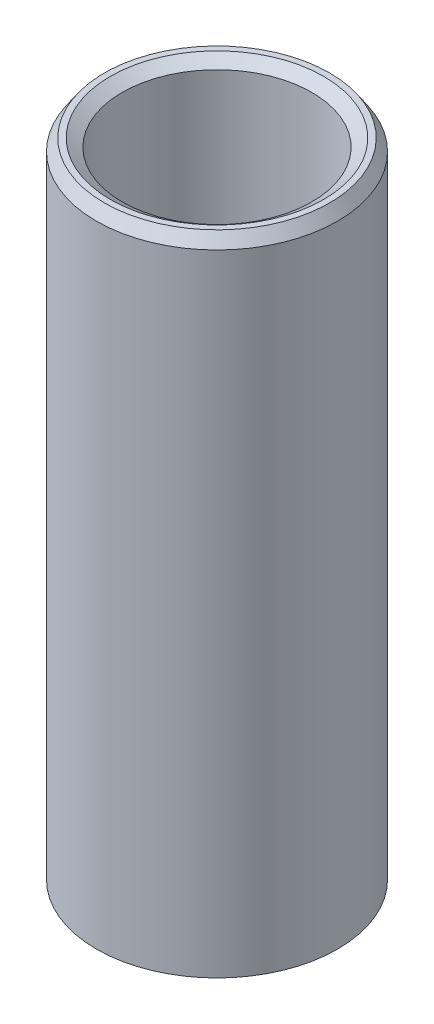
from build123d import *
from OCP.BRepFilletAPI import BRepFilletAPI_MakeChamfer

# Parameters (mm, degrees)
SKETCH1_R           = 30
BOSS_EXTRUDE1_DEPTH = 161.752572281
SKETCH2_R           = 23.596968355
CUT_EXTRUDE1_DEPTH  = 168.224085106
CHAMFER1_SIZE       = 2.93662861
CHAMFER1_SIZE2      = 1.987251083


with BuildPart() as part:
    # Sketch1 → Boss-Extrude1 (new body)
    with BuildSketch(Plane(origin=(0, 0, 0), x_dir=(1, 0, 0), z_dir=(0, 1, 0))):
        Circle(SKETCH1_R)
    extrude(amount=BOSS_EXTRUDE1_DEPTH)

    # Sketch2 → Cut-Extrude1 (cut, through all)
    with BuildSketch(Plane(origin=(0, 0, 0), x_dir=(1, 0, 0), z_dir=(0, 1, 0))):
        Circle(SKETCH2_R)
    extrude(amount=CUT_EXTRUDE1_DEPTH, mode=Mode.SUBTRACT)

    # Chamfer1: one chamfer whose edges measure the first distance from different faces: ONE call of the kernel's chamfer builder (chamfer() names one face for all edges)
    chamfer1_edges_1 = [part.edges().sort_by_distance(p)[0] for p in [
        (-23.596968355, 161.752572281, 0),
    ]]
    chamfer1_side_1 = [part.faces().sort_by_distance(p)[0] for p in [
        (-29.151471863, 161.752572281, 0),
    ]]
    chamfer1_edges_2 = [part.edges().sort_by_distance(p)[0] for p in [
        (-23.596968355, 0, 0),
    ]]
    chamfer1_side_2 = [part.faces().sort_by_distance(p)[0] for p in [
        (-23.596968355, 80.87628614, 0),
    ]]
    chamfer1_edges_3 = [part.edges().sort_by_distance(p)[0] for p in [
        (-30, 0, 0),
    ]]
    chamfer1_side_3 = [part.faces().sort_by_distance(p)[0] for p in [
        (-29.151471863, 0, 0),
    ]]
    chamfer1_edges_4 = [part.edges().sort_by_distance(p)[0] for p in [
        (-30, 161.752572281, 0),
    ]]
    chamfer1_side_4 = [part.faces().sort_by_distance(p)[0] for p in [
        (-30, 80.87628614, 0),
    ]]
    chamfer1 = BRepFilletAPI_MakeChamfer(part.part.solid().wrapped)
    for e in chamfer1_edges_1:
        chamfer1.Add(CHAMFER1_SIZE, CHAMFER1_SIZE2, e.wrapped, chamfer1_side_1[0].wrapped)  # the first distance lies on this face
    for e in chamfer1_edges_2:
        chamfer1.Add(CHAMFER1_SIZE, CHAMFER1_SIZE2, e.wrapped, chamfer1_side_2[0].wrapped)  # the first distance lies on this face
    for e in chamfer1_edges_3:
        chamfer1.Add(CHAMFER1_SIZE, CHAMFER1_SIZE2, e.wrapped, chamfer1_side_3[0].wrapped)  # the first distance lies on this face
    for e in chamfer1_edges_4:
        chamfer1.Add(CHAMFER1_SIZE, CHAMFER1_SIZE2, e.wrapped, chamfer1_side_4[0].wrapped)  # the first distance lies on this face
    add(Compound.cast(chamfer1.Shape()), mode=Mode.REPLACE)


solid = part.part
